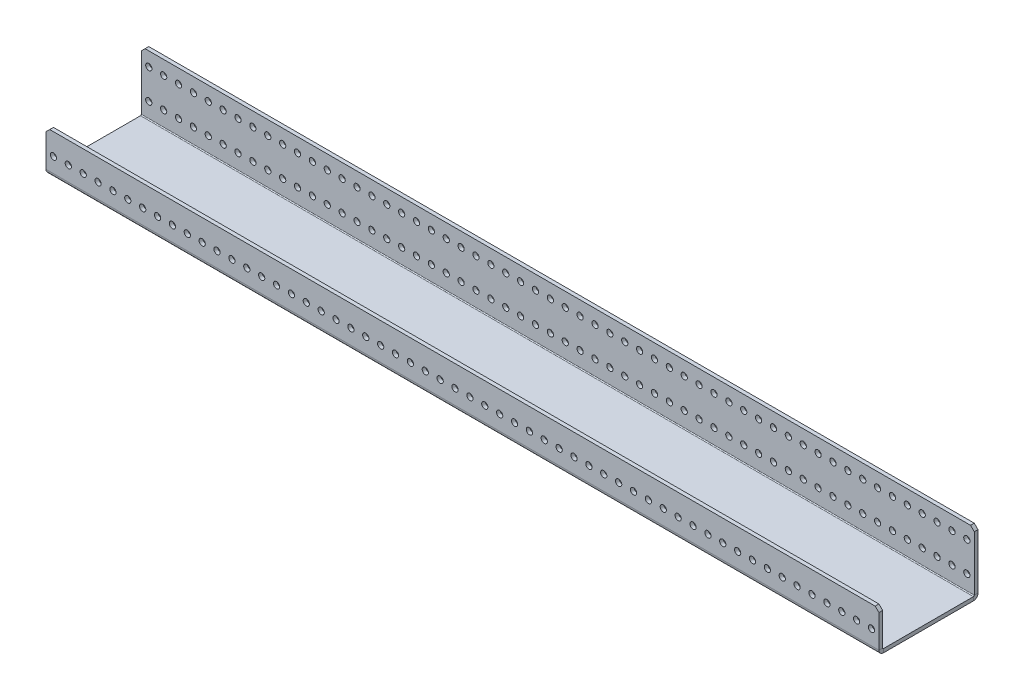
from build123d import *

# Parameters (mm, degrees)
SKETCH1_W                    = 787.4
SKETCH1_H                    = 78.232
BOSS_EXTRUDE1_DEPTH          = 3.175
EDGE_FLANGE1_STRIP_W         = 14.224
EDGE_FLANGE1_STRIP_H         = 3.175
EDGE_FLANGE1_STRIP_CUT_DEPTH = 787.4
EDGE_FLANGE1_DEPTH           = 787.4
EDGE_FLANGE2_STRIP_W         = 14.224
EDGE_FLANGE2_STRIP_H         = 3.175
EDGE_FLANGE2_STRIP_CUT_DEPTH = 787.4
EDGE_FLANGE2_DEPTH           = 787.4
SKETCH9_R                    = 2.667
CUT_EXTRUDE1_DEPTH           = 794.767078776
CHAMFER1_SIZE                = 3.175
LPATTERN1_COUNT              = 62
LPATTERN1_PITCH              = 12.7
SKETCH14_R                   = 2.667
CUT_EXTRUDE6_DEPTH           = 5.08
LPATTERN4_COUNT              = 62
LPATTERN4_PITCH              = 12.7
SKETCH15_W                   = 76.2
SKETCH15_H                   = 84.582
CUT_EXTRUDE7_DEPTH           = 794.435038471
CHAMFER2_SIZE                = 3.175


# Sheet-metal steps are written as plain solids
with BuildPart() as part:
    # Sketch1 → Boss-Extrude1 (new body)
    with BuildSketch(Plane(origin=(0, 0, 0), x_dir=(1, 0, 0), z_dir=(0, 1, 0))):
        with Locations((393.7, 39.116)):
            Rectangle(SKETCH1_W, SKETCH1_H)
    extrude(amount=BOSS_EXTRUDE1_DEPTH)

    # Edge-Flange1 strip (across the edge) → Edge-Flange1 strip cut (cut)
    with BuildSketch(Plane(origin=(787.4, 3.175, -78.232), x_dir=(0, 0, 1), z_dir=(-1, 0, 0))):
        with Locations((-6.35, -1.5875)):
            Rectangle(EDGE_FLANGE1_STRIP_W, EDGE_FLANGE1_STRIP_H)
    extrude(amount=EDGE_FLANGE1_STRIP_CUT_DEPTH, mode=Mode.SUBTRACT)

    # Edge-Flange1 section (across the edge) → Edge-Flange1 (add)
    with BuildSketch(Plane(origin=(787.4, 3.175, -78.232), x_dir=(0, 0, 1), z_dir=(-1, 0, 0))):
        with BuildLine():
            Line((-3.175, 0.762), (-3.175, 50.8))
            Line((-3.175, 50.8), (0, 50.8))
            Line((0, 50.8), (0, 0.762))
            ThreePointArc((0, 0.762), (0.223184633, 0.223184633), (0.762, 0))
            Line((0.762, 0), (0.762, -3.175))
            ThreePointArc((0.762, -3.175), (-2.021879398, -2.021879398), (-3.175, 0.762))
        make_face()
    extrude(amount=EDGE_FLANGE1_DEPTH)

    # Edge-Flange2 strip (across the edge) → Edge-Flange2 strip cut (cut)
    with BuildSketch(Plane(origin=(0, 3.175, 0), x_dir=(0, 0, -1), z_dir=(1, 0, 0))):
        with Locations((-6.35, -1.5875)):
            Rectangle(EDGE_FLANGE2_STRIP_W, EDGE_FLANGE2_STRIP_H)
    extrude(amount=EDGE_FLANGE2_STRIP_CUT_DEPTH, mode=Mode.SUBTRACT)

    # Edge-Flange2 section (across the edge) → Edge-Flange2 (add)
    with BuildSketch(Plane(origin=(0, 3.175, 0), x_dir=(0, 0, -1), z_dir=(1, 0, 0))):
        with BuildLine():
            Line((-3.175, 0.762), (-3.175, 31.75))
            Line((-3.175, 31.75), (0, 31.75))
            Line((0, 31.75), (0, 0.762))
            ThreePointArc((0, 0.762), (0.223184633, 0.223184633), (0.762, 0))
            Line((0.762, 0), (0.762, -3.175))
            ThreePointArc((0.762, -3.175), (-2.021879398, -2.021879398), (-3.175, 0.762))
        make_face()
    extrude(amount=EDGE_FLANGE2_DEPTH)

    # Sketch9 → Cut-Extrude1 (cut, through all)
    with BuildSketch(Plane.XY.offset(3.175)):
        with Locations((781.05, 16.637)):
            Circle(SKETCH9_R)
    cut_extrude1 = extrude(amount=-CUT_EXTRUDE1_DEPTH, mode=Mode.SUBTRACT)

    # Chamfer1
    chamfer1_edges = [part.edges().sort_by_distance(p)[0] for p in [
        (787.4, 53.975, -79.8195),
        (0, 53.975, -79.8195),
        (0, 34.925, 1.5875),
        (787.4, 34.925, 1.5875),
    ]]
    chamfer(chamfer1_edges, length=CHAMFER1_SIZE)

    # LPattern1: Cut-Extrude1 ×62
    with Locations(*[(-i * LPATTERN1_PITCH, 0, 0) for i in range(1, LPATTERN1_COUNT)]):
        add(cut_extrude1, mode=Mode.SUBTRACT)

    # Sketch14 → Cut-Extrude6 (cut)
    with BuildSketch(Plane(origin=(0, 0, -81.407), x_dir=(-1, 0, 0), z_dir=(0, 0, -1))):
        with Locations(Location((-781.05, 42.037, 0), (0, 0, 90))):
            Circle(SKETCH14_R)
    cut_extrude6 = extrude(amount=-CUT_EXTRUDE6_DEPTH, mode=Mode.SUBTRACT)

    # LPattern4: Cut-Extrude6 ×62
    with Locations(*[(-i * LPATTERN4_PITCH, 0, 0) for i in range(1, LPATTERN4_COUNT)]):
        add(cut_extrude6, mode=Mode.SUBTRACT)

    # Sketch15 → Cut-Extrude7 (cut, through all)
    with BuildSketch(Plane.XZ):
        with Locations((38.1, -39.116)):
            Rectangle(SKETCH15_W, SKETCH15_H)
    extrude(amount=-CUT_EXTRUDE7_DEPTH, mode=Mode.SUBTRACT)

    # Chamfer2
    chamfer2_edges = [part.edges().sort_by_distance(p)[0] for p in [
        (76.2, 34.925, 1.5875),
        (76.2, 53.975, -79.8195),
    ]]
    chamfer(chamfer2_edges, length=CHAMFER2_SIZE)


solid = part.part
